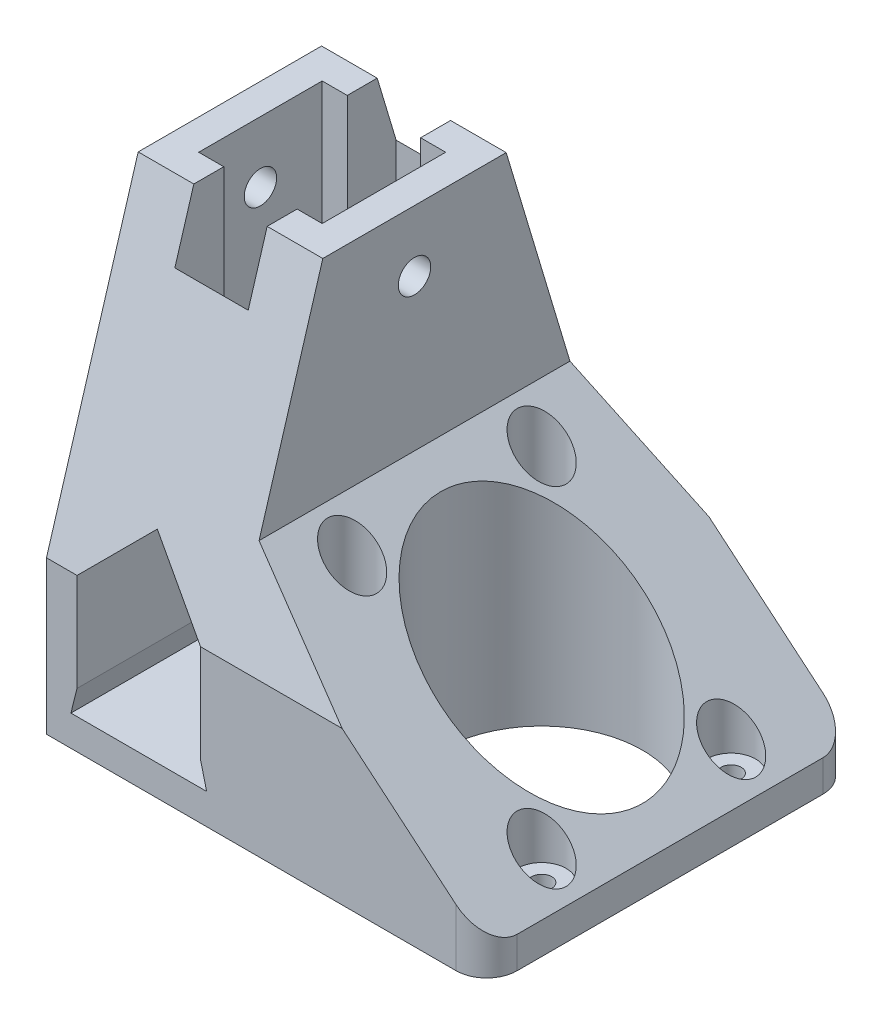
from build123d import *

# Parameters (mm, degrees)
SKETCH1_W               = 72
SKETCH1_H               = 60
BOSS_EXTRUDE1_DEPTH     = 5
SKETCH2_W               = 5
SKETCH2_H               = 60
BOSS_EXTRUDE2_DEPTH     = 70
SKETCH3_W               = 5
SKETCH3_H               = 60
BOSS_EXTRUDE3_DEPTH     = 70
BOSS_EXTRUDE4_DEPTH     = 60
CHAMFER1_SIZE           = 42
CHAMFER1_SIZE_2         = 35.242184509
CHAMFER2_SIZE           = 15.000718891
CHAMFER2_SIZE_2         = 50
SKETCH12_W              = 20.2
SKETCH12_H              = 20.2
CUT_EXTRUDE8_DEPTH      = 67
CUT_EXTRUDE1_DEPTH      = 117.978630527
CUT_EXTRUDE1_DEPTH_BACK = 117.978630527
SKETCH5_R               = 16.5
SKETCH6_R               = 1.65
CUT_EXTRUDE2_DEPTH      = 121.037494142
SKETCH7_R               = 4
CUT_EXTRUDE4_DEPTH      = 117.978630527
CUT_EXTRUDE5_DEPTH      = 105.748460609
CUT_EXTRUDE5_DEPTH_BACK = 105.748460609
SKETCH8_R               = 2.65
CUT_EXTRUDE6_DEPTH      = 121.037494142
CUT_EXTRUDE6_DEPTH_BACK = 121.037494142
SKETCH9_R               = 2.65
FILLET1_R               = 5
SKETCH10_R              = 2.65
CUT_EXTRUDE7_DEPTH      = 10
CUT_EXTRUDE9_DEPTH      = 121.037494142
CUT_EXTRUDE9_DEPTH_BACK = 121.037494142
CUT_EXTRUDE10_REACH     = 122.037
SKETCH14_W              = 12
SKETCH14_H              = 8


with BuildPart() as part:
    # Sketch1 → Boss-Extrude1 (new body)
    with BuildSketch(Plane(origin=(0, 0, 0), x_dir=(1, 0, 0), z_dir=(0, 1, 0))):
        with Locations((36, 30)):
            Rectangle(SKETCH1_W, SKETCH1_H)
    extrude(amount=BOSS_EXTRUDE1_DEPTH)

    # Sketch2 → Boss-Extrude2 (add)
    with BuildSketch(Plane(origin=(0, 5, 0), x_dir=(1, 0, 0), z_dir=(0, 1, 0))):
        with Locations((2.5, 30)):
            Rectangle(SKETCH2_W, SKETCH2_H)
    extrude(amount=BOSS_EXTRUDE2_DEPTH)

    # Sketch3 → Boss-Extrude3 (add)
    with BuildSketch(Plane(origin=(0, 5, 0), x_dir=(1, 0, 0), z_dir=(0, 1, 0))):
        with Locations((27.7, 30)):
            Rectangle(SKETCH3_W, SKETCH3_H)
    extrude(amount=BOSS_EXTRUDE3_DEPTH)

    # Sketch11 → Boss-Extrude4 (add)
    with BuildSketch(Plane(origin=(0, 0, -60), x_dir=(-1, 0, 0), z_dir=(0, 0, -1))):
        Polygon((-25.2, 25), (-15.1, 35.1), (-5, 25), (-5, 75), (-25.2, 75), align=None)
    extrude(amount=-BOSS_EXTRUDE4_DEPTH)

    # Chamfer1
    # the kernel refuses this chamfer: 42, 35.242184509 mm, written as the material it adds along each edge
    with BuildSketch(Plane(origin=(30.2, 5, -60), x_dir=(0.9996889667359942, -0.02493932209023436, 0), z_dir=(0, 0, 1))) as chamfer1_piece_1_section:
        Polygon((CHAMFER1_SIZE * 0.999688966736, CHAMFER1_SIZE * 0.0249393220902), (-CHAMFER1_SIZE_2 * 0.0249393220905, CHAMFER1_SIZE_2 * 0.999688966749), (0, 0), align=None)
    chamfer1_piece_1 = extrude(amount=60, mode=Mode.PRIVATE)
    chamfer1_piece_1 = split(chamfer1_piece_1, bisect_by=Plane(origin=(72, 16.573415306, -30), z_dir=(-1, 0, 0)), keep=Keep.TOP, mode=Mode.PRIVATE)
    add(chamfer1_piece_1)

    # Chamfer2
    # the kernel refuses this chamfer: 50, 15.000718891 mm, written as the material it takes off along each edge
    with BuildSketch(Plane(origin=(159.997065138, 75, -60), x_dir=(0, 0.12207157319780576, 0.9925213000318999), z_dir=(-1, 0, 0))) as chamfer2_piece_1:
        Polygon((CHAMFER2_SIZE * 0.99252130002, -CHAMFER2_SIZE * 0.122071573196), (-CHAMFER2_SIZE_2 * 0.122071573198, -CHAMFER2_SIZE_2 * 0.992521300032), (0, 0), align=None)
    extrude(amount=289.794130277, mode=Mode.SUBTRACT)
    with BuildSketch(Plane(origin=(159.997065138, 75, 0), x_dir=(0, 0.12207157319780576, -0.9925213000318999), z_dir=(-1, 0, 0))) as chamfer2_piece_2:
        Polygon((CHAMFER2_SIZE * 0.99252130002, CHAMFER2_SIZE * 0.122071573196), (-CHAMFER2_SIZE_2 * 0.122071573198, CHAMFER2_SIZE_2 * 0.992521300032), (0, 0), align=None)
    extrude(amount=289.794130277, mode=Mode.SUBTRACT)

    # Sketch12 → Cut-Extrude8 (cut)
    with BuildSketch(Plane(origin=(0, 75, 0), x_dir=(1, 0, 0), z_dir=(0, 1, 0))):
        with Locations((15.1, 30)):
            Rectangle(SKETCH12_W, SKETCH12_H)
    extrude(amount=-CUT_EXTRUDE8_DEPTH, mode=Mode.SUBTRACT)

    # Sketch5 → Cut-Extrude1 (cut, two sides: drawn at the far end of the back side and taken through both)
    with BuildSketch(Plane(origin=(0, 5, 0), x_dir=(1, 0, 0), z_dir=(0, 1, 0)).offset(-CUT_EXTRUDE1_DEPTH_BACK)):
        with Locations(Location((51, 30, 0), (0, 0, 270))):
            Circle(SKETCH5_R)
    extrude(amount=CUT_EXTRUDE1_DEPTH + CUT_EXTRUDE1_DEPTH_BACK, mode=Mode.SUBTRACT)

    # Sketch6 → Cut-Extrude2 (cut, through all)
    with BuildSketch(Plane.XZ):
        with Locations(Location((66.5, -14.5, 0), (0, 0, 270))):
            Circle(SKETCH6_R)
        with Locations(Location((66.5, -45.5, 0), (0, 0, 270))):
            Circle(SKETCH6_R)
        with Locations(Location((35.5, -45.5, 0), (0, 0, 270))):
            Circle(SKETCH6_R)
        with Locations(Location((35.5, -14.5, 0), (0, 0, 270))):
            Circle(SKETCH6_R)
    extrude(amount=-CUT_EXTRUDE2_DEPTH, mode=Mode.SUBTRACT)

    # Sketch7 → Cut-Extrude4 (cut, through all)
    with BuildSketch(Plane(origin=(0, 5, 0), x_dir=(1, 0, 0), z_dir=(0, 1, 0))):
        with Locations((66.5, 45.5)):
            Circle(SKETCH7_R)
        with Locations((66.5, 14.5)):
            Circle(SKETCH7_R)
        with Locations((35.5, 14.5)):
            Circle(SKETCH7_R)
        with Locations((35.5, 45.5)):
            Circle(SKETCH7_R)
    extrude(amount=CUT_EXTRUDE4_DEPTH, mode=Mode.SUBTRACT)

    # Sketch8 → Cut-Extrude5 (cut, two sides: drawn at the far end of the back side and taken through both)
    with BuildSketch(Plane(origin=(30.2, 0, 0), x_dir=(0, 0, -1), z_dir=(1, 0, 0)).offset(-CUT_EXTRUDE5_DEPTH_BACK)):
        with Locations((30, 65)):
            Circle(SKETCH8_R)
    extrude(amount=CUT_EXTRUDE5_DEPTH + CUT_EXTRUDE5_DEPTH_BACK, mode=Mode.SUBTRACT)

    # Sketch9 → Cut-Extrude6 (cut, two sides: drawn at the far end of the back side and taken through both)
    with BuildSketch(Plane.XZ.offset(-CUT_EXTRUDE6_DEPTH_BACK)):
        with Locations(Location((15, -30, 0), (0, 0, 270))):
            Circle(SKETCH9_R)
    extrude(amount=CUT_EXTRUDE6_DEPTH + CUT_EXTRUDE6_DEPTH_BACK, mode=Mode.SUBTRACT)

    # Fillet1
    fillet1_edges = [part.edges().sort_by_distance(p)[0] for p in [
        (72, 2.583909963, -60),
        (72, 2.583909963, 0),
    ]]
    fillet(fillet1_edges, radius=FILLET1_R)

    # Sketch10 → Cut-Extrude7 (cut)
    with BuildSketch(Plane.ZY):
        with Locations((-30, 15)):
            Circle(SKETCH10_R)
    extrude(amount=-CUT_EXTRUDE7_DEPTH, mode=Mode.SUBTRACT)

    # Sketch13 → Cut-Extrude9 (cut, two sides: drawn at the far end of the back side and taken through both)
    with BuildSketch(Plane.XY.offset(-CUT_EXTRUDE9_DEPTH_BACK)):
        Polygon((5, 5), (4, 5), (5, 9), align=None)
        Polygon((25.2, 5), (26.2, 5), (25.2, 9), align=None)
    extrude(amount=CUT_EXTRUDE9_DEPTH + CUT_EXTRUDE9_DEPTH_BACK, mode=Mode.SUBTRACT)

    # Cut-Extrude10: up to this face of the body (flat: up to its plane)
    cut_extrude10_end = Plane(part.part.faces().sort_by_distance((15.1, 5, -59.366909169))[0])
    # Sketch14 → Cut-Extrude10 (cut, up to the picked face)
    with BuildSketch(Plane(origin=(0, 75, 0), x_dir=(1, 0, 0), z_dir=(0, 1, 0)), mode=Mode.PRIVATE) as cut_extrude10_sk1:
        with Locations((15.1, 44.1)):
            Rectangle(SKETCH14_W, SKETCH14_H)
    cut_extrude10_tool1 = split(extrude(cut_extrude10_sk1.sketch, amount=-CUT_EXTRUDE10_REACH, mode=Mode.PRIVATE), bisect_by=cut_extrude10_end, keep=Keep.BOTH, mode=Mode.PRIVATE)
    # Sketch14 → Cut-Extrude10 (cut, up to the picked face)
    with BuildSketch(Plane(origin=(0, 75, 0), x_dir=(1, 0, 0), z_dir=(0, 1, 0)), mode=Mode.PRIVATE) as cut_extrude10_sk2:
        with Locations((15.1, 15.9)):
            Rectangle(SKETCH14_W, SKETCH14_H)
    cut_extrude10_tool2 = split(extrude(cut_extrude10_sk2.sketch, amount=-CUT_EXTRUDE10_REACH, mode=Mode.PRIVATE), bisect_by=cut_extrude10_end, keep=Keep.BOTH, mode=Mode.PRIVATE)
    add(cut_extrude10_tool1.solids().sort_by(Axis((15.1, 75, -44.1), (0, -1, 0)))[0], mode=Mode.SUBTRACT)
    add(cut_extrude10_tool2.solids().sort_by(Axis((15.1, 75, -15.9), (0, -1, 0)))[0], mode=Mode.SUBTRACT)


solid = part.part
